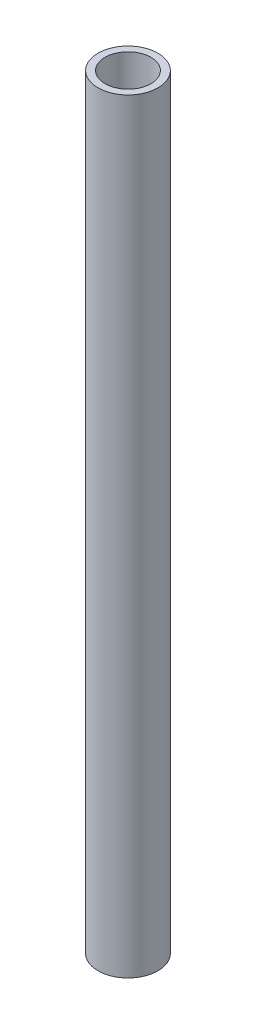
from build123d import *

# Parameters (mm, degrees)
SKETCH1_R    = 0.6477
SKETCH1_R_2  = 0.4953
NEEDLE_DEPTH = 16.51


with BuildPart() as part:
    # Sketch1 → Needle (new body)
    with BuildSketch(Plane(origin=(0, 0, 0), x_dir=(1, 0, 0), z_dir=(0, 1, 0))):
        Circle(SKETCH1_R)
        Circle(SKETCH1_R_2, mode=Mode.SUBTRACT)
    extrude(amount=-NEEDLE_DEPTH)


solid = part.part
